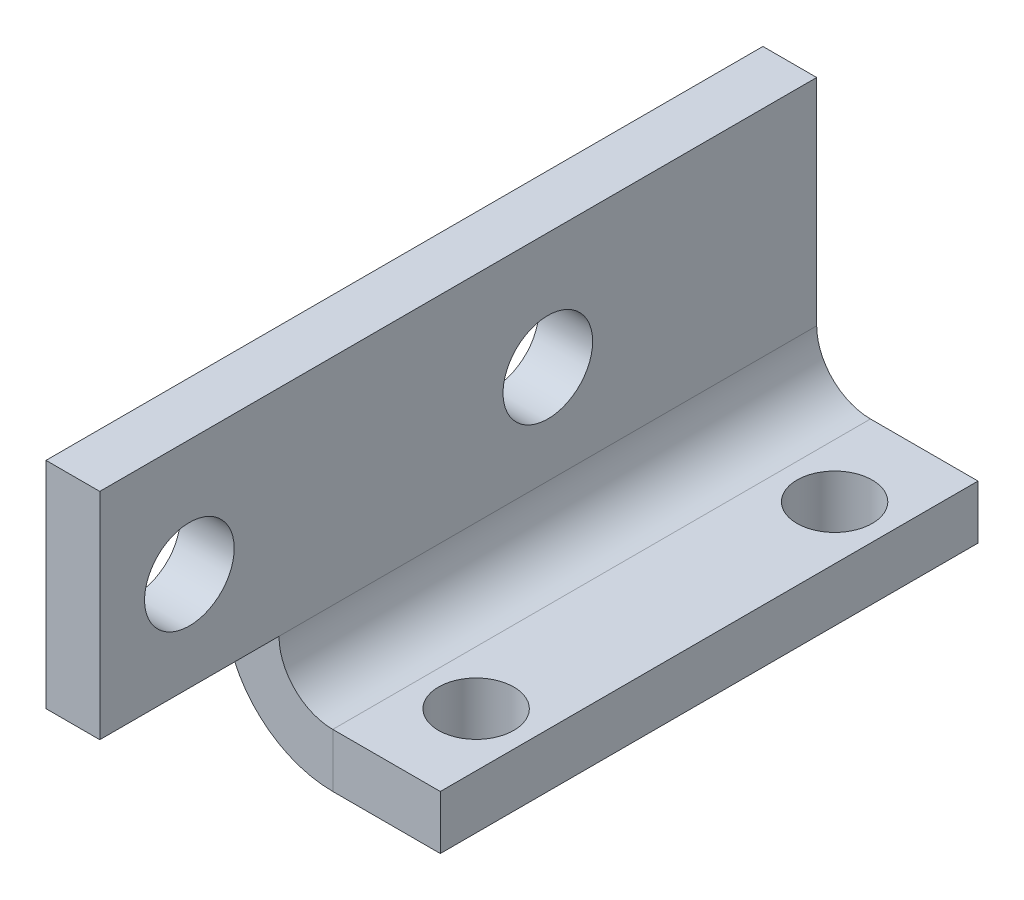
from build123d import *

# Parameters (mm, degrees)
SKETCH2_W              = 9
SKETCH2_H              = 30
BOSS_EXTRUDE1_DEPTH    = 3
M5X0_8_TAPPED_HOLE1_D  = 4.2
SKETCH6_W              = 3
SKETCH6_H              = 30
BOSS_EXTRUDE2_DEPTH    = 18
CONVERT_SOLID5_START   = -30
CONVERT_SOLID5_DEPTH   = 30
CONVERT_SOLID5_2_DEPTH = 30
SKETCH24_W             = 3
SKETCH24_H             = 12
BOSS_EXTRUDE3_DEPTH    = 10
SKETCH21_R             = 2.5
CUT_EXTRUDE1_DEPTH     = 3


# Read off the part's stored shape, not the designer's step: Convert-Solid5
with BuildPart() as part:
    # Sketch2 → Boss-Extrude1 (new body)
    with BuildSketch(Plane(origin=(0, 0, 0), x_dir=(1, 0, 0), z_dir=(0, 1, 0))):
        with Locations((4.5, 15)):
            Rectangle(SKETCH2_W, SKETCH2_H)
    extrude(amount=BOSS_EXTRUDE1_DEPTH)

    # M5x0.8 Tapped Hole1 (through all)
    with Locations(Plane(origin=(0, 3, 0), x_dir=(1, 0, 0), z_dir=(0, 1, 0))):
        with Locations((6, 25), (6, 5)):
            Hole(M5X0_8_TAPPED_HOLE1_D / 2)

    # Sketch6 → Boss-Extrude2 (add)
    with BuildSketch(Plane(origin=(0, 0, 0), x_dir=(1, 0, 0), z_dir=(0, 1, 0))):
        with Locations((-1.5, 15)):
            Rectangle(SKETCH6_W, SKETCH6_H)
    extrude(amount=BOSS_EXTRUDE2_DEPTH)

    # Convert-Solid5 outline → Convert-Solid5 (cut)
    with BuildSketch(Plane.XY.offset(CONVERT_SOLID5_START)):
        with BuildLine():
            Line((-3, 0), (3, 0))
            ThreePointArc((3, 0), (-1.242640687, 1.757359313), (-3, 6))
            Line((-3, 6), (-3, 0))
        make_face()
    extrude(amount=CONVERT_SOLID5_DEPTH, mode=Mode.SUBTRACT)

    # Convert-Solid5 2 outline → Convert-Solid5 2 (add)
    with BuildSketch(Plane.XY.offset(CONVERT_SOLID5_START)):
        with BuildLine():
            Line((0, 3), (3, 3))
            ThreePointArc((3, 3), (0.878679656, 3.878679656), (0, 6))
            Line((0, 6), (0, 3))
        make_face()
    extrude(amount=CONVERT_SOLID5_2_DEPTH)

    # Sketch24 → Boss-Extrude3 (add)
    with BuildSketch(Plane.XY):
        with Locations((-1.5, 12)):
            Rectangle(SKETCH24_W, SKETCH24_H)
    extrude(amount=BOSS_EXTRUDE3_DEPTH)

    # Sketch21 → Cut-Extrude1 (cut)
    with BuildSketch(Plane(origin=(0, 0, 0), x_dir=(0, 0, -1), z_dir=(1, 0, 0))):
        with Locations((-5, 11.5)):
            Circle(SKETCH21_R)
        with Locations((15, 11.5)):
            Circle(SKETCH21_R)
    extrude(amount=-CUT_EXTRUDE1_DEPTH, mode=Mode.SUBTRACT)


solid = part.part
